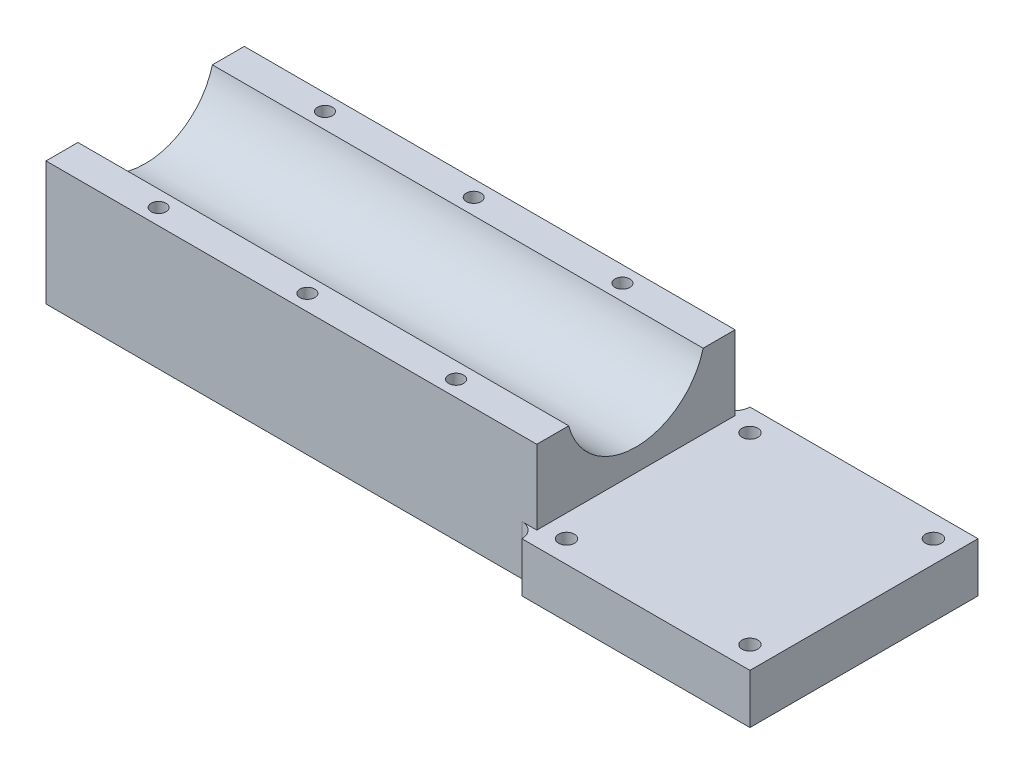
from build123d import *

# Parameters (mm, degrees)
SKETCH_1_W          = 40
SKETCH_1_H          = 25
EXTRUDE_1_DEPTH     = 99
SKETCH_2_R          = 14
CUT_EXTRUDE_1_DEPTH = 110.66312051
SKETCH_3_W          = 46
SKETCH_3_H          = 46
EXTRUDE_2_DEPTH     = 10
SKETCH_4_R          = 1.6
CUT_EXTRUDE_2_DEPTH = 10
SKETCH_5_R          = 3
CUT_EXTRUDE_3_DEPTH = 4
FILLET_1_R          = 3
SKETCH_6_R          = 1.5
CUT_EXTRUDE_4_DEPTH = 10


with BuildPart() as part:
    # 草图1 → 凸台-拉伸1 (new body)
    with BuildSketch(Plane(origin=(0, 0, 0), x_dir=(0, 0, -1), z_dir=(1, 0, 0))):
        with Locations((20, -12.5)):
            Rectangle(SKETCH_1_W, SKETCH_1_H)
    extrude(amount=EXTRUDE_1_DEPTH)

    # 草图2 → 切除-拉伸1 (cut, through all)
    with BuildSketch(Plane.ZY):
        with Locations((-20, 3.5)):
            Circle(SKETCH_2_R)
    extrude(amount=-CUT_EXTRUDE_1_DEPTH, mode=Mode.SUBTRACT)

    # 草图3 → 凸台-拉伸2 (add)
    with BuildSketch(Plane(origin=(0, -25, 0), x_dir=(-1, 0, 0), z_dir=(0, -1, 0))):
        with Locations((-122, 20)):
            Rectangle(SKETCH_3_W, SKETCH_3_H)
    extrude(amount=-EXTRUDE_2_DEPTH)

    # 草图4 → 切除-拉伸2 (cut)
    with BuildSketch(Plane(origin=(0, -25, 0), x_dir=(-1, 0, 0), z_dir=(0, -1, 0))):
        with Locations(Location((-103.5, 1.5, 0), (0, 0, 90))):
            Circle(SKETCH_4_R)
        with Locations(Location((-140.5, 1.5, 0), (0, 0, 90))):
            Circle(SKETCH_4_R)
        with Locations(Location((-103.5, 38.5, 0), (0, 0, 90))):
            Circle(SKETCH_4_R)
        with Locations(Location((-140.5, 38.5, 0), (0, 0, 90))):
            Circle(SKETCH_4_R)
    extrude(amount=-CUT_EXTRUDE_2_DEPTH, mode=Mode.SUBTRACT)

    # 草图5 → 切除-拉伸3 (cut)
    with BuildSketch(Plane(origin=(0, -25, 0), x_dir=(-1, 0, 0), z_dir=(0, -1, 0))):
        with Locations(Location((-103.5, 1.5, 0), (0, 0, 90))):
            Circle(SKETCH_5_R)
        with Locations(Location((-103.5, 38.5, 0), (0, 0, 90))):
            Circle(SKETCH_5_R)
        with Locations(Location((-140.5, 38.5, 0), (0, 0, 90))):
            Circle(SKETCH_5_R)
        with Locations(Location((-140.5, 1.5, 0), (0, 0, 90))):
            Circle(SKETCH_5_R)
    extrude(amount=-CUT_EXTRUDE_3_DEPTH, mode=Mode.SUBTRACT)

    # 圆角1
    fillet_1_edges = [part.edges().sort_by_distance(p)[0] for p in [
        (99, -20, -40),
        (99, -20, 0),
    ]]
    fillet(fillet_1_edges, radius=FILLET_1_R - 0.0001)  # a hair under: the kernel refuses the full size

    # 草图6 → 切除-拉伸4 (cut)
    with BuildSketch(Plane(origin=(0, 0, 0), x_dir=(1, 0, 0), z_dir=(0, 1, 0))):
        with Locations(Location((49.5, 36.777720856, 0), (0, 0, 270))):
            Circle(SKETCH_6_R)
        with Locations(Location((49.5, 3.222279144, 0), (0, 0, 270))):
            Circle(SKETCH_6_R)
        with Locations(Location((19.5, 36.777720856, 0), (0, 0, 270))):
            Circle(SKETCH_6_R)
        with Locations(Location((19.5, 3.222279144, 0), (0, 0, 270))):
            Circle(SKETCH_6_R)
        with Locations(Location((79.5, 36.777720856, 0), (0, 0, 270))):
            Circle(SKETCH_6_R)
        with Locations(Location((79.5, 3.222279144, 0), (0, 0, 270))):
            Circle(SKETCH_6_R)
    extrude(amount=-CUT_EXTRUDE_4_DEPTH, mode=Mode.SUBTRACT)


solid = part.part
